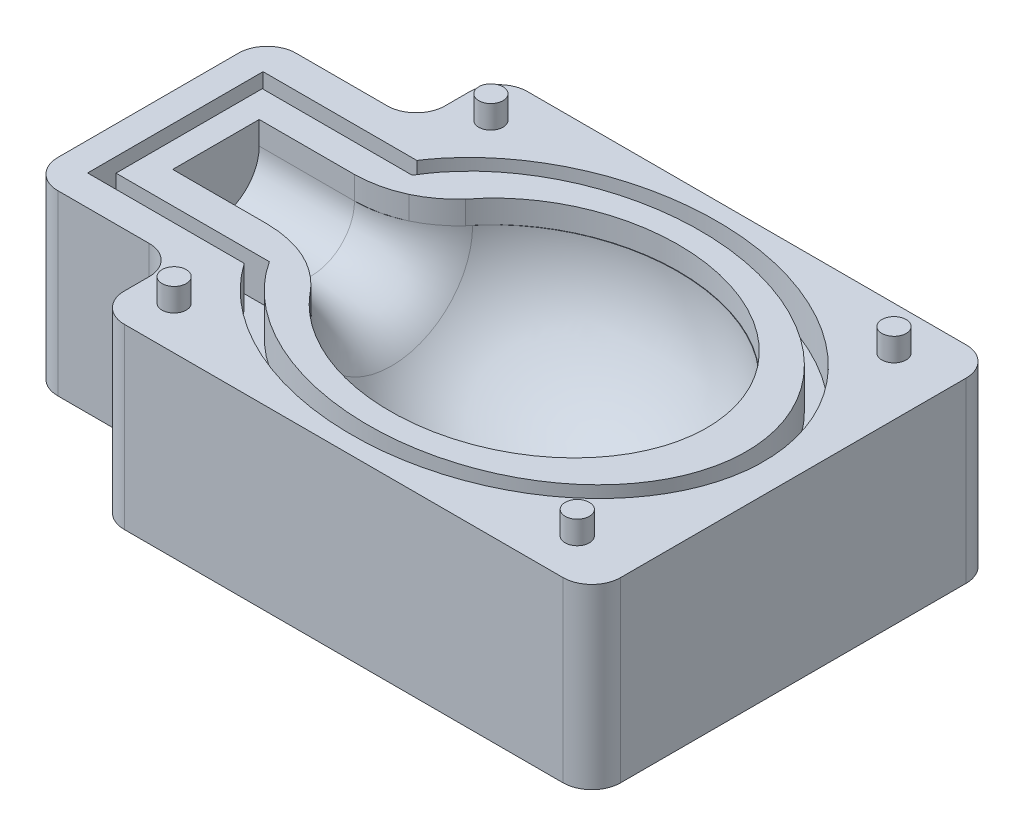
from build123d import *

# Parameters (mm, degrees)
ESQUISSE1_W                              = 134.027110592
ESQUISSE1_H                              = 30.020319582
BOSS_EXTRU_1_DEPTH                       = 70
ENL_VEMENT_DE_MATI_RE_R_VOLUTION47_ANGLE = 180
ENL_VEMENT_START                         = -55.237277286
ENL_VEMENT_DE_MATI_RE_R_VOLUTION48_DEPTH = 26.622938225
CONG_1_R                                 = 18
ESQUISSE10_W                             = 21.986593138
ESQUISSE10_H                             = 30.020319582
ENL_V_MAT_EXTRU_2_DEPTH                  = 99.061824992
ENL_V_MAT_EXTRU_5_DEPTH                  = 3
ESQUISSE15_R                             = 2.1
BOSS_EXTRU_2_DEPTH                       = 8
ESQUISSE16_W                             = 70
ESQUISSE16_H                             = 3.151513928
ENL_V_MAT_EXTRU_6_DEPTH                  = 135.099012082
ESQUISSE17_W                             = 25.861301644
ESQUISSE17_H                             = 14.321648992
ENL_V_MAT_EXTRU_7_DEPTH                  = 101.562166534
BOSS_EXTRU_5_DEPTH                       = 4
CONG_4_R                                 = 5


# Read off the part's stored shape, not the designer's step: Enlèvement de matière-Révolution48
with BuildPart() as part:
    # Esquisse1 → Boss.-Extru.1 (new body)
    with BuildSketch(Plane.XY):
        Rectangle(ESQUISSE1_W, ESQUISSE1_H)
    extrude(amount=BOSS_EXTRU_1_DEPTH)

    # Esquisse6 → Enlèvement de matière-Révolution47 (revolve, cut)
    with BuildSketch(Plane(origin=(0, 15.010159791, 0), x_dir=(1, 0, 0), z_dir=(0, 1, 0))):
        with BuildLine():
            Line((-30, -35), (30, -35))
            add(Edge.make_bspline(
                [(30, -35), (30, -10), (0, -10), (-30, -10), (-30, -35)],
                knots=[0, 0, 0, 1.570796327, 1.570796327, 3.141592654, 3.141592654, 3.141592654], degree=2, weights=[1, 0.707106781, 1, 0.707106781, 1]))
        make_face()
    revolve(axis=Axis((67.013555296, 15.010159791, 35), (-1, 0, 0)), revolution_arc=ENL_VEMENT_DE_MATI_RE_R_VOLUTION47_ANGLE, mode=Mode.SUBTRACT)

    # Enlèvement de matière-Révolution48 outli → Enlèvement de matière-Révolution48 (cut)
    with BuildSketch(Plane.YZ.offset(ENL_VEMENT_START)):
        with BuildLine():
            Line((15.010159791, 27.489840209), (15.010159791, 42.510159791))
            ThreePointArc((15.010159791, 42.510159791), (7.5, 35), (15.010159791, 27.489840209))
        make_face()
    extrude(amount=ENL_VEMENT_DE_MATI_RE_R_VOLUTION48_DEPTH, mode=Mode.SUBTRACT)

    # Congé1
    cong_1_edges = [part.edges().sort_by_distance(p)[0] for p in [
        (-28.614339061, 7.5, 35),
    ]]
    fillet(cong_1_edges, radius=CONG_1_R)

    # Esquisse10 → Enlèv. mat.-Extru.2 (cut, through all)
    with BuildSketch(Plane(origin=(0, 0, 0), x_dir=(-1, 0, 0), z_dir=(0, 0, -1))):
        with Locations((-56.020258727, 0)):
            Rectangle(ESQUISSE10_W, ESQUISSE10_H)
    extrude(amount=-ENL_V_MAT_EXTRU_2_DEPTH, mode=Mode.SUBTRACT)

    # Esquisse14 → Enlèv. mat.-Extru.5 (cut)
    with BuildSketch(Plane(origin=(0, 15.010159791, 0), x_dir=(1, 0, 0), z_dir=(0, 1, 0))):
        with BuildLine():
            Line((-36.95065792, -22.593731953), (-33.568216071, -22.593731953))
            add(Edge.make_bspline(
                [(-32.969763, -47.992109896), (-11.968044376, -80.456384186), (23.634832969, -57.413436774), (59.237710315, -34.370489362), (22.565908506, -12.048229698), (-14.105893303, 10.274029966), (-33.568216071, -22.593731953)],
                knots=[3.621962513, 3.621962513, 3.621962513, 5.414642661, 5.414642661, 7.207322809, 7.207322809, 9.000002957, 9.000002957, 9.000002957], degree=2, weights=[1, 0.624472717, 1, 0.624472717, 1, 0.624472717, 1]))
            Line((-32.969763, -47.992109896), (-36.439122288, -47.992109896))
            add(Edge.make_bspline(
                [(-36.439122288, -47.992109896), (-35.734455038, -49.237206185), (-34.899635372, -50.4303054)],
                knots=[3.575076272, 3.575076272, 3.575076272, 3.671550289, 3.671550289, 3.671550289], degree=2, weights=[1, 0.979509213, 0.961188751]))
            add(Edge.make_bspline(
                [(-34.899635372, -50.4303054), (-11.819428822, -83.415843998), (25.026969924, -59.963213412), (65.234193612, -34.371427073), (24.010934913, -9.515816182), (-13.543091018, 13.127426623), (-35.401513383, -19.963295045)],
                knots=[3.671550289, 3.671550289, 3.671550289, 5.396765185, 5.396765185, 7.218454098, 7.218454098, 8.937188842, 8.937188842, 8.937188842], degree=2, weights=[0.961188751, 0.633569616, 1, 0.613078829, 1, 0.634945981, 0.958737375]))
            add(Edge.make_bspline(
                [(-35.401513383, -19.963295045), (-36.251462308, -21.250003794), (-36.95065792, -22.593731953)],
                knots=[8.937188842, 8.937188842, 8.937188842, 9.04014301, 9.04014301, 9.04014301], degree=2, weights=[0.958737375, 0.978132848, 1]))
        make_face()
        with BuildLine():
            Line((-59.600015614, -22.593731953), (-36.95065792, -22.593731953))
            add(Edge.make_bspline(
                [(-35.401513383, -19.963295045), (-36.251462308, -21.250003794), (-36.95065792, -22.593731953)],
                knots=[8.937188842, 8.937188842, 8.937188842, 9.04014301, 9.04014301, 9.04014301], degree=2, weights=[0.958737375, 0.978132848, 1]))
            Line((-35.401513383, -19.963295045), (-62.094279206, -19.963295045))
            Line((-62.094279206, -19.963295045), (-62.094279206, -50.4303054))
            Line((-62.094279206, -50.4303054), (-34.899635372, -50.4303054))
            add(Edge.make_bspline(
                [(-36.439122288, -47.992109896), (-35.734455038, -49.237206185), (-34.899635372, -50.4303054)],
                knots=[3.575076272, 3.575076272, 3.575076272, 3.671550289, 3.671550289, 3.671550289], degree=2, weights=[1, 0.979509213, 0.961188751]))
            Line((-36.439122288, -47.992109896), (-59.600015614, -47.992109896))
            Line((-59.600015614, -47.992109896), (-59.600015614, -22.593731953))
        make_face()
    extrude(amount=-ENL_V_MAT_EXTRU_5_DEPTH, mode=Mode.SUBTRACT)

    # Esquisse15 → Boss.-Extru.2 (add)
    with BuildSketch(Plane(origin=(0, 15.010159791, 0), x_dir=(1, 0, 0), z_dir=(0, 1, 0))):
        with Locations(Location((35, -7.5, 0), (0, 0, 90))):
            Circle(ESQUISSE15_R)
        with Locations(Location((35, -62.5, 0), (0, 0, 90))):
            Circle(ESQUISSE15_R)
        with Locations(Location((-35, -62.5, 0), (0, 0, 90))):
            Circle(ESQUISSE15_R)
        with Locations(Location((-35, -7.5, 0), (0, 0, 90))):
            Circle(ESQUISSE15_R)
    extrude(amount=BOSS_EXTRU_2_DEPTH)

    # Esquisse16 → Enlèv. mat.-Extru.6 (cut, through all)
    with BuildSketch(Plane.ZY.offset(67.013555296)):
        with Locations((35, -13.434402827)):
            Rectangle(ESQUISSE16_W, ESQUISSE16_H)
    extrude(amount=-ENL_V_MAT_EXTRU_6_DEPTH, mode=Mode.SUBTRACT)

    # Esquisse17 → Enlèv. mat.-Extru.7 (cut, through all)
    with BuildSketch(Plane(origin=(0, 15.010159791, 0), x_dir=(1, 0, 0), z_dir=(0, 1, 0))):
        with Locations((-54.082904474, -7.160824496)):
            Rectangle(ESQUISSE17_W, ESQUISSE17_H)
        with Locations((-54.082904474, -62.839175504)):
            Rectangle(ESQUISSE17_W, ESQUISSE17_H)
    extrude(amount=-ENL_V_MAT_EXTRU_7_DEPTH, mode=Mode.SUBTRACT)

    # Esquisse20 → Boss.-Extru.5 (add)
    # profile 1 of 2: a face of its own
    with BuildSketch(Plane(origin=(0, 15.010159791, 0), x_dir=(1, 0, 0), z_dir=(0, 1, 0))):
        Polygon((45.026962158, 0), (45.026962158, -70), (-41.152253652, -70), (-41.152253652, -55.678351008), (-67.013555296, -55.678351008), (-67.013555296, -14.321648992), (-41.152253652, -14.321648992), (-41.152253652, 0), align=None)
        with BuildLine():
            add(Edge.make_bspline(
                [(-34.899635372, -50.4303054), (-11.189269952, -84.316448145), (25.845144494, -59.428068792), (62.87955894, -34.539689439), (25.033448499, -10.153245549), (-12.812661942, 14.233198341), (-35.401513383, -19.963295045)],
                knots=[0.518859018, 0.518859018, 0.518859018, 2.281679333, 2.281679333, 4.044499648, 4.044499648, 5.807319963, 5.807319963, 5.807319963], degree=2, weights=[1, 0.636063648, 1, 0.636063648, 1, 0.636063648, 1]))
            Line((-35.401513383, -19.963295045), (-62.094279206, -19.963295045))
            Line((-62.094279206, -19.963295045), (-62.094279206, -50.4303054))
            Line((-62.094279206, -50.4303054), (-34.899635372, -50.4303054))
        make_face(mode=Mode.SUBTRACT)
    # profile 2 of 2: a face of its own
    with BuildSketch(Plane(origin=(0, 15.010159791, 0), x_dir=(1, 0, 0), z_dir=(0, 1, 0))):
        with BuildLine():
            Line((-33.568216071, -22.593731953), (-59.600015614, -22.593731953))
            Line((-59.600015614, -22.593731953), (-59.600015614, -47.992109896))
            Line((-59.600015614, -47.992109896), (-32.969763, -47.992109896))
            add(Edge.make_bspline(
                [(-32.969763, -47.992109896), (-11.968044376, -80.456384186), (23.634832969, -57.413436774), (59.237710315, -34.370489362), (22.565908506, -12.048229698), (-14.105893303, 10.274029966), (-33.568216071, -22.593731953)],
                knots=[0.480369859, 0.480369859, 0.480369859, 2.273050007, 2.273050007, 4.065730155, 4.065730155, 5.858410303, 5.858410303, 5.858410303], degree=2, weights=[1, 0.624472717, 1, 0.624472717, 1, 0.624472717, 1]))
        make_face()
        with BuildLine():
            Line((-55.237277286, -42.510159791), (-55.237277286, -27.489840209))
            Line((-55.237277286, -27.489840209), (-38.69474691, -27.489840209))
            add(Edge.make_bspline(
                [(-30.993504838, -25.759163198), (-34.501258477, -27.396796907), (-38.69474691, -27.489840209)],
                knots=[0.452418314, 0.452418314, 0.452418314, 1, 1, 1], degree=2))
            ThreePointArc((-30.993504838, -25.759163198), (-27.954098082, -23.934163064), (-25.331342938, -21.548838271))
            add(Edge.make_bspline(
                [(29.944974728, -33.486521544), (24.470190351, 43.980960377), (-25.331342938, -21.548838271)],
                knots=[3.218940486, 3.218940486, 3.218940486, 5.710738844, 5.710738844, 5.710738844], degree=2, weights=[0.958369595, 0.298233392, 0.984262602]))
            add(Edge.make_bspline(
                [(30, -35), (30, -34.242566139), (29.944974728, -33.486521544)],
                knots=[0, 0, 0, 0.078856001, 0.078856001, 0.078856001], degree=2, weights=[1, 0.978137837, 0.957631861]))
            add(Edge.make_bspline(
                [(-0.457721152, -59.997089988), (30, -60.384389048), (30, -35)],
                knots=[4.73845509, 4.73845509, 4.73845509, 6.283185307, 6.283185307, 6.283185307], degree=2, weights=[0.663894635, 0.571736542, 1]))
            add(Edge.make_bspline(
                [(-24.773191944, -49.100063065), (-16.004019642, -59.799403932), (-0.457721152, -59.997089988)],
                knots=[3.740817477, 3.740817477, 3.740817477, 4.73845509, 4.73845509, 4.73845509], degree=2, weights=[1, 0.723413365, 0.663894635]))
            ThreePointArc((-24.773191944, -49.100063065), (-27.613710951, -46.325286084), (-30.993504838, -44.240836802))
            add(Edge.make_bspline(
                [(-38.69474691, -42.510159791), (-34.509787293, -42.615652498), (-30.993504838, -44.240836802)],
                knots=[0, 0, 0, 0.547040616, 0.547040616, 0.547040616], degree=2))
            Line((-38.69474691, -42.510159791), (-55.237277286, -42.510159791))
        make_face(mode=Mode.SUBTRACT)
    extrude(amount=BOSS_EXTRU_5_DEPTH)

    # Congé4
    cong_4_edges = [part.edges().sort_by_distance(p)[0] for p in [
        (-67.013555296, 3.575756964, 14.321648992),
        (-41.152253652, 3.575756964, 0),
        (-41.152253652, 3.575756964, 14.321648992),
        (-67.013555296, 3.575756964, 55.678351008),
        (-41.152253652, 3.575756964, 55.678351008),
        (-41.152253652, 3.575756964, 70),
        (45.026962158, 3.575756964, 0),
        (45.026962158, 3.575756964, 70),
    ]]
    fillet(cong_4_edges, radius=CONG_4_R)


solid = part.part
